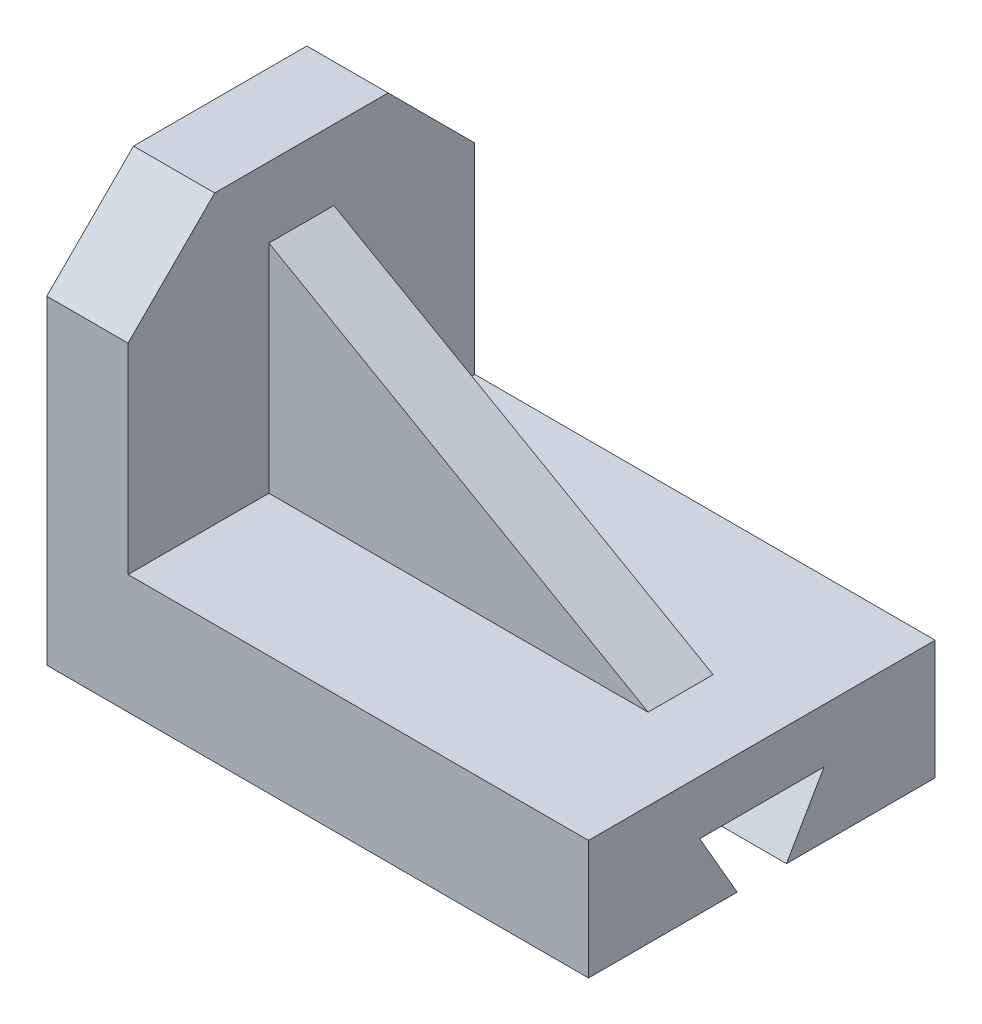
from build123d import *

# Parameters (mm, degrees)
SKETCH1_W               = 100
SKETCH1_H               = 64
BOSS_EXTRUDE1_DEPTH     = 22
CUT_EXTRUDE1_DEPTH      = 108.275346655
CUT_EXTRUDE1_DEPTH_BACK = 108.275346655
SKETCH4_W               = 15
SKETCH4_H               = 64
BOSS_EXTRUDE2_DEPTH     = 53
CHAMFER1_SIZE           = 16
CHAMFER2_SIZE           = 16
RIB1_REACH              = 97.65
SKETCH5_WALL_W          = 273.923387726
SKETCH5_WALL_H          = 12


with BuildPart() as part:
    # Sketch1 → Boss-Extrude1 (new body)
    with BuildSketch(Plane(origin=(0, 0, 0), x_dir=(1, 0, 0), z_dir=(0, 1, 0))):
        Rectangle(SKETCH1_W, SKETCH1_H)
    extrude(amount=BOSS_EXTRUDE1_DEPTH)

    # Sketch2 → Cut-Extrude1 (cut, two sides: drawn at the far end of the back side and taken through both)
    with BuildSketch(Plane(origin=(50, 0, 0), x_dir=(0, 0, -1), z_dir=(1, 0, 0)).offset(-CUT_EXTRUDE1_DEPTH_BACK)):
        Polygon((-43.110063235, -82.552699055), (4.551759787, 0), (11.479963017, 12), (-11.479963017, 12), (-4.551759787, 0), (43.110063235, -82.552699055), (43.110063235, 108.094593032), (-43.110063235, 108.094593032), align=None)
    extrude(amount=CUT_EXTRUDE1_DEPTH + CUT_EXTRUDE1_DEPTH_BACK, mode=Mode.SUBTRACT)

    # Sketch4 → Boss-Extrude2 (add)
    with BuildSketch(Plane(origin=(0, 22, 0), x_dir=(1, 0, 0), z_dir=(0, 1, 0))):
        with Locations((-42.5, 0)):
            Rectangle(SKETCH4_W, SKETCH4_H)
    extrude(amount=BOSS_EXTRUDE2_DEPTH)

    # Chamfer1
    chamfer1_edges = [part.edges().sort_by_distance(p)[0] for p in [
        (-42.5, 75, 32),
    ]]
    chamfer(chamfer1_edges, length=CHAMFER1_SIZE)

    # Chamfer2
    chamfer2_edges = [part.edges().sort_by_distance(p)[0] for p in [
        (-42.5, 75, -32),
    ]]
    chamfer(chamfer2_edges, length=CHAMFER2_SIZE)

    # Sketch5 wall → Rib1 (add, up to next)
    with BuildSketch(Plane(origin=(0, 42, 0), x_dir=(0.868243142124, -0.496138938357, 0), z_dir=(0.496138938357, 0.868243142124, 0)), mode=Mode.PRIVATE) as rib1_sk1:
        Rectangle(SKETCH5_WALL_W, SKETCH5_WALL_H)
    rib1_tool1 = extrude(rib1_sk1.sketch, amount=-RIB1_REACH, mode=Mode.PRIVATE) - part.part
    add(rib1_tool1.solids().sort_by_distance((0, 42, 0))[0])


solid = part.part
